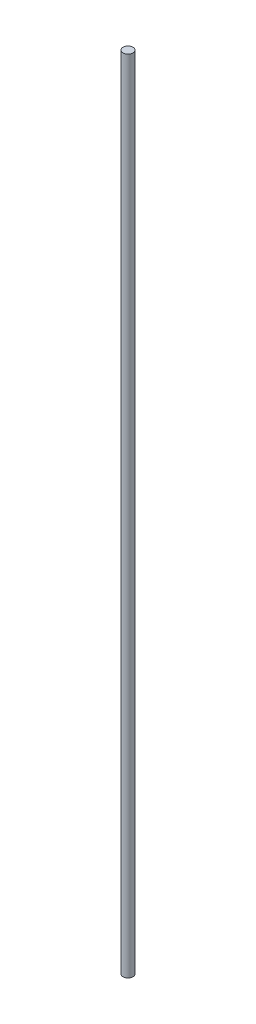
from build123d import *

# Parameters (mm, degrees)
SKETCH1_R           = 5.08
BOSS_EXTRUDE1_DEPTH = 817.88


with BuildPart() as part:
    # Sketch1 → Boss-Extrude1 (new body)
    with BuildSketch(Plane(origin=(0, 0, 0), x_dir=(1, 0, 0), z_dir=(0, 1, 0))):
        Circle(SKETCH1_R)
    extrude(amount=BOSS_EXTRUDE1_DEPTH)


solid = part.part
